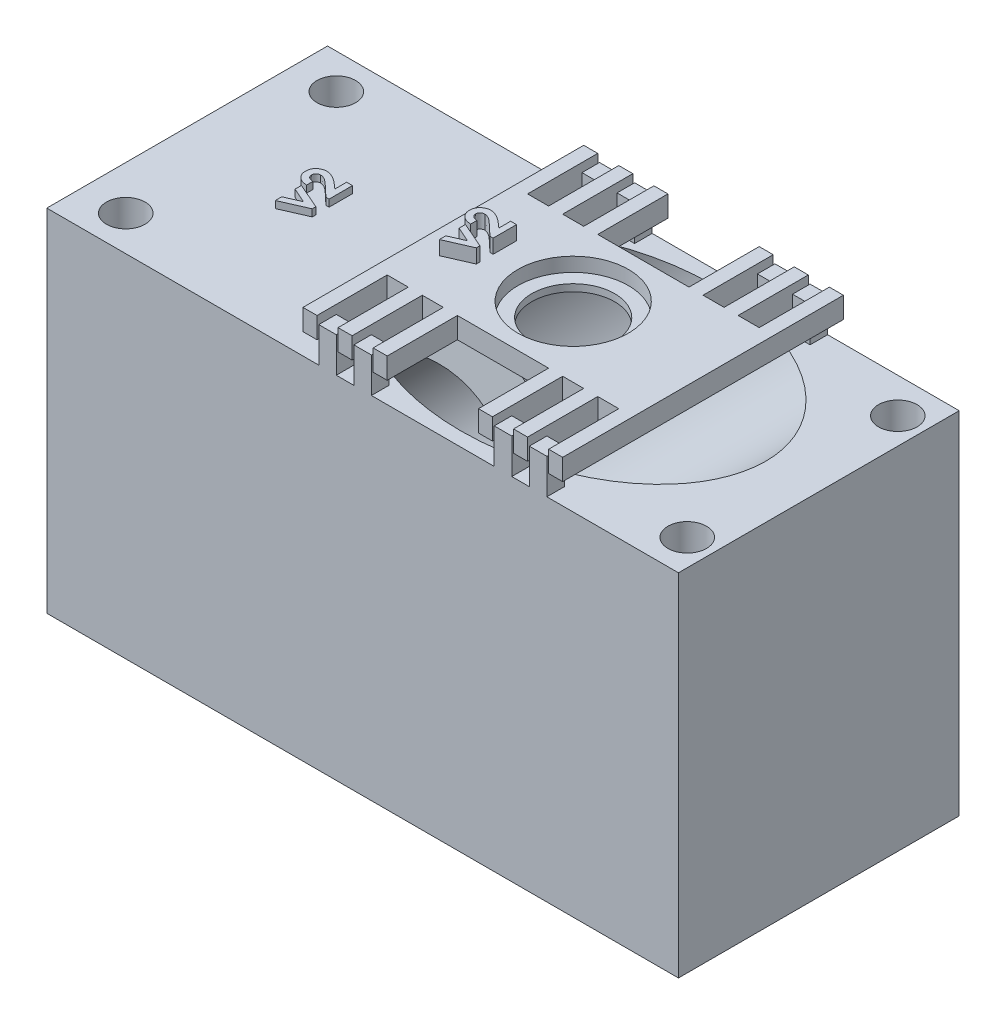
from build123d import *

# Parameters (mm, degrees)
SKETCH1_W            = 228.6
SKETCH1_H            = 127
BOSS_EXTRUDE1_DEPTH  = 50.8
SKETCH10_R           = 7.5
CUT_EXTRUDE6_DEPTH   = 196.514014843
SKETCH11_W           = 25
SKETCH11_H           = 25
CUT_EXTRUDE7_DEPTH   = 2.54
SKETCH13_W           = 6.35
SKETCH13_H           = 6.35
BOSS_EXTRUDE3_DEPTH  = 12.7
BOSS_EXTRUDE4_START  = -7.62
BOSS_EXTRUDE4_DEPTH  = 7.62
SKETCH4_R            = 14.9987
CUT_EXTRUDE9_DEPTH   = 206.74
SKETCH3_R            = 20.0025
CUT_EXTRUDE10_DEPTH  = 5.08
SKETCH7_R            = 6.985
CUT_EXTRUDE4_DEPTH   = 196.514014843
LPATTERN1_COUNT      = 2
LPATTERN1_PITCH      = 76.2
LPATTERN1_COUNT_DIR2 = 2
LPATTERN1_PITCH_DIR2 = 203.2
BOSS_EXTRUDE2_DEPTH  = 2.54
BOSS_EXTRUDE6_DEPTH  = 5.08


with BuildPart() as part:
    # Sketch1 → Boss-Extrude1 (new, symmetric)
    with BuildSketch(Plane.XY):
        with Locations((-25.4, -63.5)):
            Rectangle(SKETCH1_W, SKETCH1_H)
    extrude(amount=BOSS_EXTRUDE1_DEPTH, both=True)

    # Sketch10 → Cut-Extrude6 (cut, through all)
    with BuildSketch(Plane.XZ.offset(127)):
        Circle(SKETCH10_R)
    extrude(amount=-CUT_EXTRUDE6_DEPTH, mode=Mode.SUBTRACT)

    # Sketch11 → Cut-Extrude7 (cut)
    with BuildSketch(Plane.XZ.offset(127)):
        Rectangle(SKETCH11_W, SKETCH11_H)
    extrude(amount=-CUT_EXTRUDE7_DEPTH, mode=Mode.SUBTRACT)

    # Sketch2 → Cut-Revolve1 (revolve, cut)
    with BuildSketch(Plane.XY):
        Polygon((-108.275018762, -95.39450652), (-120.937179893, -82.73234539), (-82.681288817, -44.476454314), (-93.367793601, -33.78994953), (-64.657844072, -5.08), (0, 59.577844072), (29.864008255, 89.441852327), (59.72801651, 54.64801651), (0, -5.08), (-105.207008528, -110.287008528), (-129.286668415, -134.366668415), (-180.402882779, -185.482882779), (-189.3831389, -176.502626658), align=None)
    revolve(axis=Axis((-124.923032936, -130.003032936, 0), (0.7071067811865462, 0.7071067811865489, 0)), mode=Mode.SUBTRACT)

    # Sketch13 → Boss-Extrude3 (add)
    with BuildSketch(Plane(origin=(0, 0, 0), x_dir=(1, 0, 0), z_dir=(0, 1, 0))):
        with Locations((-38.1, 47.625)):
            Rectangle(SKETCH13_W, SKETCH13_H)
        with Locations((-25.4, 47.625)):
            Rectangle(SKETCH13_W, SKETCH13_H)
        with Locations((25.4, 47.625)):
            Rectangle(SKETCH13_W, SKETCH13_H)
        with Locations((38.1, 47.625)):
            Rectangle(SKETCH13_W, SKETCH13_H)
        with Locations((38.1, -47.625)):
            Rectangle(SKETCH13_W, SKETCH13_H)
        with Locations((25.4, -47.625)):
            Rectangle(SKETCH13_W, SKETCH13_H)
        with Locations((-25.4, -47.625)):
            Rectangle(SKETCH13_W, SKETCH13_H)
        with Locations((-38.1, -47.625)):
            Rectangle(SKETCH13_W, SKETCH13_H)
    extrude(amount=BOSS_EXTRUDE3_DEPTH)

    # Sketch7 → Cut-Extrude4 (cut, through all)
    with BuildSketch(Plane(origin=(0, 0, 0), x_dir=(1, 0, 0), z_dir=(0, 1, 0))):
        with Locations((79.375, 38.1)):
            Circle(SKETCH7_R)
    cut_extrude4 = extrude(amount=-CUT_EXTRUDE4_DEPTH, mode=Mode.SUBTRACT)

    # LPattern1: Cut-Extrude4 2 × 2
    with Locations(*[(-j * LPATTERN1_PITCH_DIR2, 0, i * LPATTERN1_PITCH) for i in range(LPATTERN1_COUNT) for j in range(LPATTERN1_COUNT_DIR2) if (i, j) != (0, 0)]):
        add(cut_extrude4, mode=Mode.SUBTRACT)

    # Sketch8 → Boss-Extrude2 (add)
    with BuildSketch(Plane(origin=(0, 0, 0), x_dir=(1, 0, 0), z_dir=(0, 1, 0))):
        Polygon((-98.180769231, -9.606410256), (-98.180769231, -7.286217949), (-92.703385417, -4.884615385), (-98.180769231, -2.483012821), (-98.180769231, -0.162820513), (-88.9, -4.228245192), (-88.9, -5.540985577), align=None)
        with BuildLine():
            Line((-97.366666667, 3.175), (-97.366666667, 0.895512821))
            add(Edge.make_bspline(
                [(-97.366666667, 0.895512821), (-97.539099617, 0.905353711), (-97.876023248, 0.92458222), (-98.365385351, 1.001152261), (-98.827891866, 1.103489853), (-99.262152319, 1.24123878), (-99.668349153, 1.410907486), (-100.045136865, 1.616718829), (-100.395215315, 1.852528015), (-100.712444826, 2.123088223), (-100.997643804, 2.417418722), (-101.246972236, 2.73476495), (-101.455692741, 3.074225442), (-101.626907123, 3.433530302), (-101.763900681, 3.811268225), (-101.855443742, 4.211255715), (-101.917451012, 4.629963407), (-101.922876019, 4.916605271), (-101.925641026, 5.062700321)],
                knots=[0, 0, 0, 0, 1.198928049, 2.342633425, 3.435730849, 4.486331048, 5.502589352, 6.488331875, 7.46361919, 8.428949135, 9.378681775, 10.305958057, 11.226249248, 12.140413166, 13.066341608, 14.010670971, 14.986082777, 16, 16, 16, 16], degree=3))
            add(Edge.make_bspline(
                [(-101.925641026, 5.062700321), (-101.920421622, 5.242110452), (-101.910227647, 5.592514971), (-101.811777963, 6.099988126), (-101.661018399, 6.576476416), (-101.441985553, 7.016911358), (-101.165783363, 7.420527202), (-100.835816352, 7.785079976), (-100.448075986, 8.103459743), (-100.0137282, 8.373183504), (-99.552896445, 8.596230844), (-99.077247579, 8.754033221), (-98.599057886, 8.857208509), (-98.277107268, 8.868238453), (-98.117167468, 8.873717949)],
                knots=[0, 0, 0, 0, 1.075374184, 2.100304875, 3.089917907, 4.066149699, 5.039978333, 6.01615708, 7.006437042, 8.039858286, 9.077679641, 10.07047942, 11.041445745, 12, 12, 12, 12], degree=3))
            add(Edge.make_bspline(
                [(-98.117167468, 8.873717949), (-98.020422707, 8.871587259), (-97.825699401, 8.867298705), (-97.531035245, 8.837479831), (-97.23088536, 8.792745613), (-96.925507055, 8.725297368), (-96.614814889, 8.64118368), (-96.29787844, 8.539142381), (-95.976497078, 8.416802905), (-95.647044023, 8.276220985), (-95.308488516, 8.10845906), (-94.955595241, 7.9133183), (-94.588739881, 7.684274703), (-94.204324098, 7.428784333), (-93.80821748, 7.136796131), (-93.396021577, 6.81604459), (-92.968385892, 6.464915128), (-92.682405939, 6.215898899), (-92.535476763, 6.087960737)],
                knots=[0, 0, 0, 0, 0.728277616, 1.465842947, 2.227925269, 3.011838508, 3.818735656, 4.650581052, 5.517389122, 6.406849312, 7.346234817, 8.360743166, 9.441530624, 10.601362564, 11.834937575, 13.145232671, 14.533293658, 16, 16, 16, 16], degree=3))
            Line((-92.535476763, 6.087960737), (-91.016666667, 4.7625))
            Line((-91.016666667, 4.7625), (-91.016666667, 9.036538462))
            Line((-91.016666667, 9.036538462), (-88.9, 9.036538462))
            Line((-88.9, 9.036538462), (-88.9, 0.569871795))
            Line((-88.9, 0.569871795), (-90.055008013, 0.569871795))
            Line((-90.055008013, 0.569871795), (-94.056830929, 4.330008013))
            add(Edge.make_bspline(
                [(-94.056830929, 4.330008013), (-94.173564185, 4.438875343), (-94.399641883, 4.649719076), (-94.731680004, 4.949699983), (-95.046708242, 5.221256106), (-95.348379881, 5.458315492), (-95.626480712, 5.675220909), (-95.891524011, 5.856678244), (-96.136045689, 6.014705351), (-96.434107888, 6.179781358), (-96.786915162, 6.340157067), (-97.1931124, 6.487219035), (-97.581615649, 6.575964884), (-97.835225947, 6.58830893), (-97.956891026, 6.594230769)],
                knots=[0, 0, 0, 0, 1.246192343, 2.413505005, 3.49357156, 4.492416076, 5.408771964, 6.246246772, 6.999304986, 7.680960093, 8.904522682, 10.020616941, 11.0504258, 12, 12, 12, 12], degree=3))
            add(Edge.make_bspline(
                [(-97.956891026, 6.594230769), (-98.074596808, 6.589814838), (-98.302670633, 6.581258262), (-98.627104435, 6.48722843), (-98.920846123, 6.341554152), (-99.175118366, 6.136278522), (-99.384070728, 5.887625442), (-99.539483625, 5.600283451), (-99.629156154, 5.276595232), (-99.640379951, 5.049683623), (-99.646153846, 4.932952724)],
                knots=[0, 0, 0, 0, 1.062038974, 2.057870785, 3.028805853, 4.01125022, 4.991535629, 5.949134679, 6.94496649, 8, 8, 8, 8], degree=3))
            add(Edge.make_bspline(
                [(-99.646153846, 4.932952724), (-99.6440209, 4.872648055), (-99.639821853, 4.75392863), (-99.611869933, 4.579420354), (-99.562607592, 4.413363192), (-99.496602988, 4.253908835), (-99.409113412, 4.102759023), (-99.301268571, 3.960295002), (-99.175809047, 3.825015735), (-99.033127136, 3.697541666), (-98.87389408, 3.581523622), (-98.69956415, 3.47847682), (-98.510245556, 3.393274269), (-98.308437593, 3.318258846), (-98.091972679, 3.260403363), (-97.862146333, 3.218277394), (-97.619332452, 3.186251833), (-97.45242074, 3.178818841), (-97.366666667, 3.175)],
                knots=[0, 0, 0, 0, 0.903469896, 1.778625579, 2.63899355, 3.493148037, 4.358286772, 5.247621495, 6.164656832, 7.118446693, 8.109501108, 9.111810964, 10.146451449, 11.215617525, 12.33435995, 13.498009769, 14.714554818, 16, 16, 16, 16], degree=3))
        make_face()
    extrude(amount=BOSS_EXTRUDE2_DEPTH)


with BuildPart() as body_2:
    # Sketch14 → Boss-Extrude4 (new body)
    with BuildSketch(Plane(origin=(0, 0, 0), x_dir=(-1, 0, 0), z_dir=(0, -1, 0)).offset(BOSS_EXTRUDE4_START)):
        Polygon((16.51, 25.4), (-16.51, 25.4), (-16.51, 50.8), (-21.59, 50.8), (-21.59, 25.4), (-29.21, 25.4), (-29.21, 50.8), (-34.29, 50.8), (-34.29, 25.4), (-41.91, 25.4), (-41.91, 50.8), (-46.99, 50.8), (-46.99, -50.8), (-41.91, -50.8), (-41.91, -25.4), (-34.29, -25.4), (-34.29, -50.8), (-29.21, -50.8), (-29.21, -25.4), (-21.59, -25.4), (-21.59, -50.8), (-16.51, -50.8), (-16.51, -25.4), (16.51, -25.4), (16.51, -50.8), (21.59, -50.8), (21.59, -25.4), (29.21, -25.4), (29.21, -50.8), (34.29, -50.8), (34.29, -25.4), (41.91, -25.4), (41.91, -50.8), (46.99, -50.8), (46.99, 50.8), (41.91, 50.8), (41.91, 25.4), (34.29, 25.4), (34.29, 50.8), (29.21, 50.8), (29.21, 25.4), (21.59, 25.4), (21.59, 50.8), (16.51, 50.8), align=None)
    extrude(amount=-BOSS_EXTRUDE4_DEPTH)

    # Sketch4 → Cut-Extrude9 (cut, through all)
    with BuildSketch(Plane(origin=(0, 15.24, 0), x_dir=(1, 0, 0), z_dir=(0, 1, 0))):
        Circle(SKETCH4_R)
    extrude(amount=-CUT_EXTRUDE9_DEPTH, mode=Mode.SUBTRACT)

    # Sketch3 → Cut-Extrude10 (cut)
    with BuildSketch(Plane(origin=(0, 15.24, 0), x_dir=(1, 0, 0), z_dir=(0, 1, 0))):
        Circle(SKETCH3_R)
    extrude(amount=-CUT_EXTRUDE10_DEPTH, mode=Mode.SUBTRACT)

    # Sketch15 → Boss-Extrude6 (add)
    with BuildSketch(Plane(origin=(0, 15.24, -15.24), x_dir=(1, 0, 0), z_dir=(0, -1, 0))):
        with BuildLine():
            Line((-37.676666667, 12.390641026), (-37.676666667, 14.670128205))
            add(Edge.make_bspline(
                [(-37.676666667, 14.670128205), (-37.849099617, 14.660287315), (-38.186023248, 14.641058806), (-38.675385351, 14.564488764), (-39.137891866, 14.462151172), (-39.572152319, 14.324402245), (-39.978349153, 14.154733539), (-40.355136865, 13.948922197), (-40.705215315, 13.71311301), (-41.022444826, 13.442552803), (-41.307643804, 13.148222304), (-41.556972236, 12.830876076), (-41.765692741, 12.491415584), (-41.936907123, 12.132110723), (-42.073900681, 11.754372801), (-42.165443742, 11.354385311), (-42.227451012, 10.935677618), (-42.232876019, 10.649035754), (-42.235641026, 10.502940705)],
                knots=[0, 0, 0, 0, 1.198928049, 2.342633425, 3.435730849, 4.486331048, 5.502589352, 6.488331875, 7.46361919, 8.428949135, 9.378681775, 10.305958057, 11.226249248, 12.140413166, 13.066341608, 14.010670971, 14.986082777, 16, 16, 16, 16], degree=3))
            add(Edge.make_bspline(
                [(-42.235641026, 10.502940705), (-42.230421622, 10.323530574), (-42.220227647, 9.973126055), (-42.121777963, 9.4656529), (-41.971018399, 8.98916461), (-41.751985553, 8.548729668), (-41.475783363, 8.145113824), (-41.145816352, 7.78056105), (-40.758075986, 7.462181283), (-40.3237282, 7.192457521), (-39.862896445, 6.969410182), (-39.387247579, 6.811607805), (-38.909057886, 6.708432517), (-38.587107268, 6.697402573), (-38.427167468, 6.691923077)],
                knots=[0, 0, 0, 0, 1.075374184, 2.100304875, 3.089917907, 4.066149699, 5.039978333, 6.01615708, 7.006437042, 8.039858286, 9.077679641, 10.07047942, 11.041445745, 12, 12, 12, 12], degree=3))
            add(Edge.make_bspline(
                [(-38.427167468, 6.691923077), (-38.330422707, 6.694053767), (-38.135699401, 6.69834232), (-37.841035245, 6.728161195), (-37.54088536, 6.772895412), (-37.235507055, 6.840343658), (-36.924814889, 6.924457345), (-36.60787844, 7.026498645), (-36.286497078, 7.14883812), (-35.957044023, 7.289420041), (-35.618488516, 7.457181965), (-35.265595241, 7.652322725), (-34.898739881, 7.881366323), (-34.514324098, 8.136856693), (-34.11821748, 8.428844895), (-33.706021577, 8.749596436), (-33.278385892, 9.100725897), (-32.992405939, 9.349742127), (-32.845476763, 9.477680288)],
                knots=[0, 0, 0, 0, 0.728277616, 1.465842947, 2.227925269, 3.011838508, 3.818735656, 4.650581052, 5.517389122, 6.406849312, 7.346234817, 8.360743166, 9.441530624, 10.601362564, 11.834937575, 13.145232671, 14.533293658, 16, 16, 16, 16], degree=3))
            Line((-32.845476763, 9.477680288), (-31.326666667, 10.803141026))
            Line((-31.326666667, 10.803141026), (-31.326666667, 6.529102564))
            Line((-31.326666667, 6.529102564), (-29.21, 6.529102564))
            Line((-29.21, 6.529102564), (-29.21, 14.995769231))
            Line((-29.21, 14.995769231), (-30.365008013, 14.995769231))
            Line((-30.365008013, 14.995769231), (-34.366830929, 11.235633013))
            add(Edge.make_bspline(
                [(-34.366830929, 11.235633013), (-34.483564185, 11.126765683), (-34.709641883, 10.915921949), (-35.041680004, 10.615941043), (-35.356708242, 10.344384919), (-35.658379881, 10.107325534), (-35.936480712, 9.890420117), (-36.201524011, 9.708962782), (-36.446045689, 9.550935675), (-36.744107888, 9.385859667), (-37.096915162, 9.225483959), (-37.5031124, 9.078421991), (-37.891615649, 8.989676142), (-38.145225947, 8.977332095), (-38.266891026, 8.971410256)],
                knots=[0, 0, 0, 0, 1.246192343, 2.413505005, 3.49357156, 4.492416076, 5.408771964, 6.246246772, 6.999304986, 7.680960093, 8.904522682, 10.020616941, 11.0504258, 12, 12, 12, 12], degree=3))
            add(Edge.make_bspline(
                [(-38.266891026, 8.971410256), (-38.384596808, 8.975826188), (-38.612670633, 8.984382764), (-38.937104435, 9.078412596), (-39.230846123, 9.224086873), (-39.485118366, 9.429362504), (-39.694070728, 9.678015584), (-39.849483625, 9.965357575), (-39.939156154, 10.289045794), (-39.950379951, 10.515957403), (-39.956153846, 10.632688301)],
                knots=[0, 0, 0, 0, 1.062038974, 2.057870785, 3.028805853, 4.01125022, 4.991535629, 5.949134679, 6.94496649, 8, 8, 8, 8], degree=3))
            add(Edge.make_bspline(
                [(-39.956153846, 10.632688301), (-39.9540209, 10.69299297), (-39.949821853, 10.811712396), (-39.921869933, 10.986220672), (-39.872607592, 11.152277834), (-39.806602988, 11.31173219), (-39.719113412, 11.462882003), (-39.611268571, 11.605346023), (-39.485809047, 11.740625291), (-39.343127136, 11.86809936), (-39.18389408, 11.984117404), (-39.00956415, 12.087164206), (-38.820245556, 12.172366757), (-38.618437593, 12.247382179), (-38.401972679, 12.305237663), (-38.172146333, 12.347363632), (-37.929332452, 12.379389193), (-37.76242074, 12.386822184), (-37.676666667, 12.390641026)],
                knots=[0, 0, 0, 0, 0.903469896, 1.778625579, 2.63899355, 3.493148037, 4.358286772, 5.247621495, 6.164656832, 7.118446693, 8.109501108, 9.111810964, 10.146451449, 11.215617525, 12.33435995, 13.498009769, 14.714554818, 16, 16, 16, 16], degree=3))
        make_face()
        Polygon((-38.490769231, 25.172051282), (-38.490769231, 22.851858974), (-33.013385417, 20.45025641), (-38.490769231, 18.048653846), (-38.490769231, 15.728461538), (-29.21, 19.793886218), (-29.21, 21.106626603), align=None)
    extrude(amount=-BOSS_EXTRUDE6_DEPTH)


solid = Compound([part.part, body_2.part])
